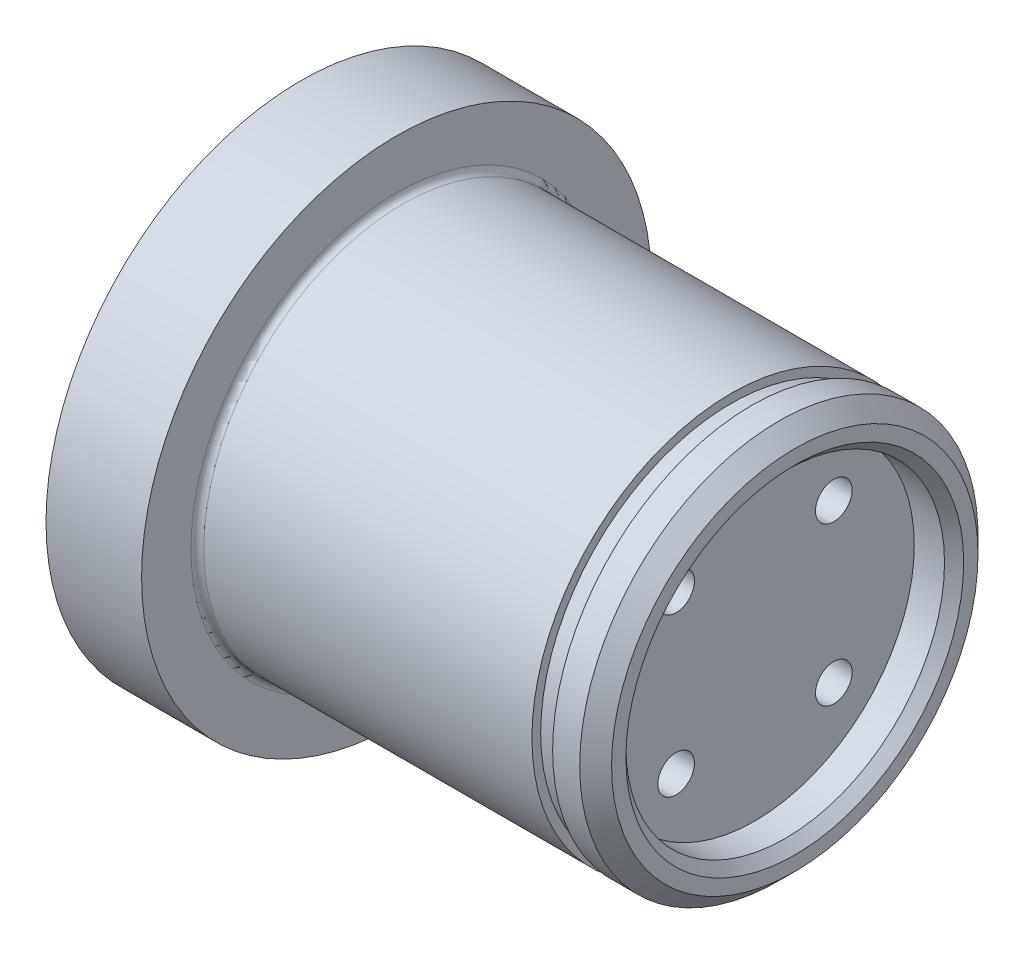
from build123d import *

# Parameters (mm, degrees)
SKETCH_2_W               = 1.3
SKETCH_2_H               = 0.55
CHAMFER_1_SIZE           = 1
FILLET_1_R               = 0.4
PATTERN_CIRCULAR_1_COUNT = 4
SKETCH_5_W               = 2.5
SKETCH_5_H               = 10
CHAMFER_2_SIZE           = 0.6
PATTERN_CIRCULAR_2_COUNT = 4


with BuildPart() as part:
    # Эскиз1 → Повернуть1 (revolve)
    with BuildSketch(Plane.XY):
        Polygon((0, 0), (0, 12.5), (-25, 12.5), (-25, 16), (-31, 16), (-31, 0), align=None)
    revolve(axis=Axis((0, 0, 0), (1, 0, 0)))

    # Эскиз2 → Вырез-Повернуть1 (revolve, cut)
    with BuildSketch(Plane.XY):
        with Locations((-3.35, 12.225)):
            Rectangle(SKETCH_2_W, SKETCH_2_H)
    revolve(axis=Axis((0, 0, 0), (-1, 0, 0)), mode=Mode.SUBTRACT)

    # Фаска1
    chamfer_1_edges = [part.edges().sort_by_distance(p)[0] for p in [
        (0, -12.5, 0),
    ]]
    chamfer(chamfer_1_edges, length=CHAMFER_1_SIZE)

    # Скругление1
    fillet_1_edges = [part.edges().sort_by_distance(p)[0] for p in [
        (-25, -12.5, 0),
    ]]
    fillet(fillet_1_edges, radius=FILLET_1_R)

    # Эскиз4 → Сверло под метчик  спиральное M2.21 (revolve, cut)
    with BuildSketch(Plane(origin=(0, 4.949747468, -4.949747468), x_dir=(0, 0, -1), z_dir=(0, 1, 0))):
        Polygon((0, 0), (0, 10.690989712), (1.15, 10), (1.15, 0), align=None)
    hole_wizard_m2_21 = revolve(axis=Axis((6.35, 4.949747468, -4.949747468), (-1, 0, 0)), mode=Mode.SUBTRACT)

    # Круговой массив1: Сверло под метчик  спиральное M2.21 ×4 about axis
    pattern_circular_1_axis = Axis((0, 0, 0), (-1, 0, 0))
    for i in range(1, PATTERN_CIRCULAR_1_COUNT):
        add(hole_wizard_m2_21.rotate(pattern_circular_1_axis, i * 360 / PATTERN_CIRCULAR_1_COUNT), mode=Mode.SUBTRACT)

    # Эскиз5 → Вырез-Повернуть2 (revolve, cut)
    with BuildSketch(Plane.XY):
        with Locations((-1.25, 5)):
            Rectangle(SKETCH_5_W, SKETCH_5_H)
    revolve(axis=Axis((0, 0, 0), (-1, 0, 0)), mode=Mode.SUBTRACT)

    # Фаска2
    chamfer_2_edges = [part.edges().sort_by_distance(p)[0] for p in [
        (0, -10, 0),
    ]]
    chamfer(chamfer_2_edges, length=CHAMFER_2_SIZE)

    # Эскиз7 → Сверло под метчик  спиральное M2.22 (revolve, cut)
    with BuildSketch(Plane(origin=(-31, 10, 0), x_dir=(0, 0, 1), z_dir=(0, 1, 0))):
        Polygon((0, 0), (0, 10.690989712), (1.15, 10), (1.15, 0), align=None)
    hole_wizard_m2_22 = revolve(axis=Axis((-37.35, 10, 0), (1, 0, 0)), mode=Mode.SUBTRACT)

    # Круговой массив2: Сверло под метчик  спиральное M2.22 ×4 about axis
    pattern_circular_2_axis = Axis((-31, 0, 0), (-1, 0, 0))
    for i in range(1, PATTERN_CIRCULAR_2_COUNT):
        add(hole_wizard_m2_22.rotate(pattern_circular_2_axis, i * 360 / PATTERN_CIRCULAR_2_COUNT), mode=Mode.SUBTRACT)


solid = part.part
